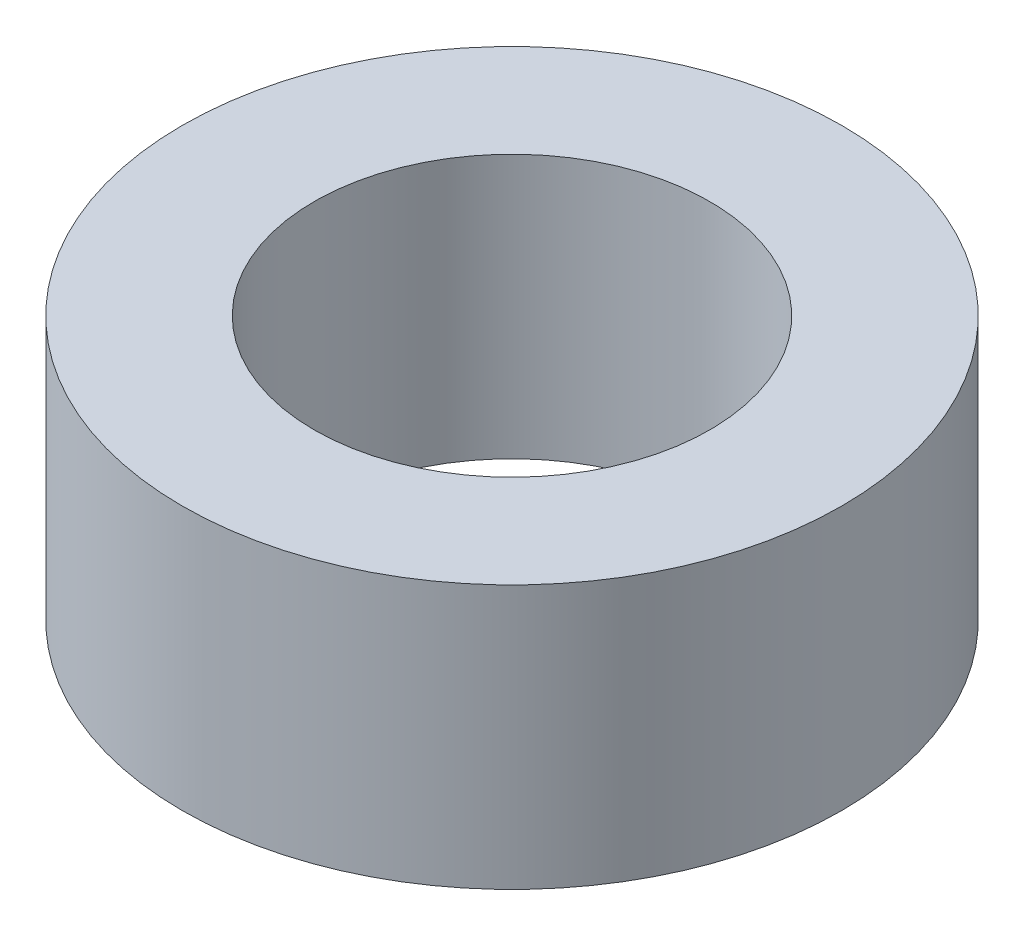
from build123d import *

# Parameters (mm, degrees)
SKETCH1_R           = 15.875
SKETCH1_R_2         = 9.525
BOSS_EXTRUDE1_DEPTH = 12.7


with BuildPart() as part:
    # Sketch1 → Boss-Extrude1 (new body)
    with BuildSketch(Plane(origin=(0, 0, 0), x_dir=(1, 0, 0), z_dir=(0, 1, 0))):
        Circle(SKETCH1_R)
        Circle(SKETCH1_R_2, mode=Mode.SUBTRACT)
    extrude(amount=BOSS_EXTRUDE1_DEPTH)


solid = part.part
